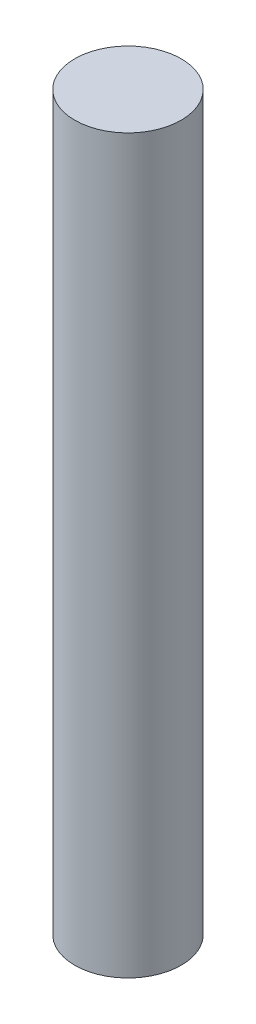
from build123d import *

# Parameters (mm, degrees)
SKETCH1_R           = 4
BOSS_EXTRUDE1_DEPTH = 55


with BuildPart() as part:
    # Sketch1 → Boss-Extrude1 (new body)
    with BuildSketch(Plane(origin=(0, 0, 0), x_dir=(1, 0, 0), z_dir=(0, 1, 0))):
        Circle(SKETCH1_R)
    extrude(amount=BOSS_EXTRUDE1_DEPTH)


solid = part.part
